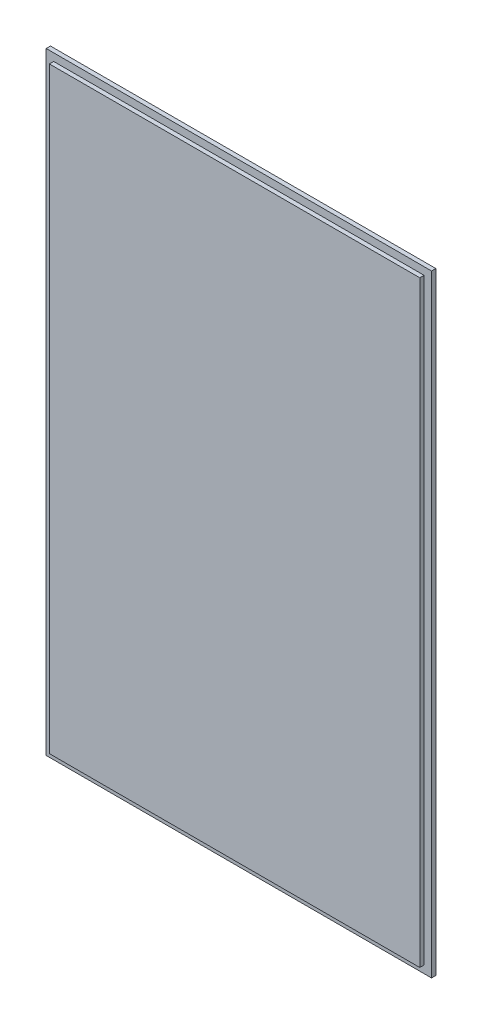
from build123d import *

# Parameters (mm, degrees)
SKICA1_W                = 72
SKICA1_H                = 114.4
P_IDAT_VYSUNUT_M1_DEPTH = 0.8
SKICA2_W                = 69.2
SKICA2_H                = 111.6
P_IDAT_VYSUNUT_M2_DEPTH = 0.8


with BuildPart() as part:
    # Skica1 → Přidat vysunutím1 (new body)
    with BuildSketch(Plane.XY):
        with Locations((36, 57.2)):
            Rectangle(SKICA1_W, SKICA1_H)
    extrude(amount=P_IDAT_VYSUNUT_M1_DEPTH)

    # Skica2 → Přidat vysunutím2 (add)
    with BuildSketch(Plane.XY.offset(0.8)):
        with Locations((36, 57.2)):
            Rectangle(SKICA2_W, SKICA2_H)
    extrude(amount=P_IDAT_VYSUNUT_M2_DEPTH)


solid = part.part
